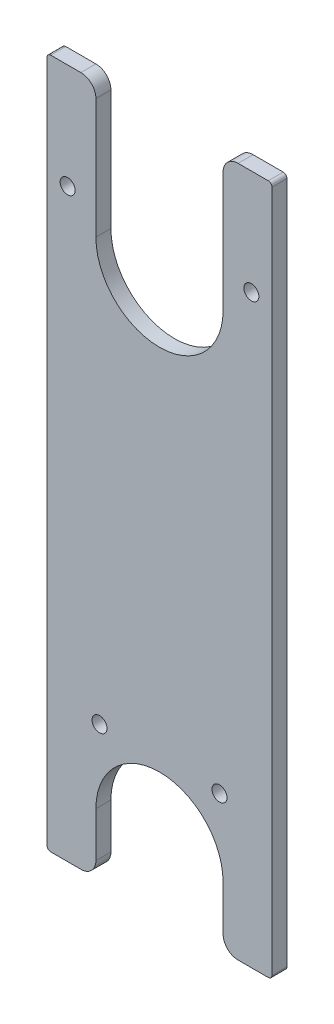
from build123d import *

# Parameters (mm, degrees)
BOSS_EXTRUDE1_DEPTH         = 6.35
FILLET1_R                   = 6.35
FILLET2_R                   = 1.5875
F_1_4_0_25_DIAMETER_HOLE1_D = 6.35


with BuildPart() as part:
    # Sketch2 → Boss-Extrude1 (new body)
    with BuildSketch(Plane.XY):
        with BuildLine():
            Line((-47.625, -279.4), (-26.924, -279.4))
            Line((-26.924, -279.4), (-26.924, -254))
            ThreePointArc((-26.924, -254), (0, -227.076), (26.924, -254))
            Line((26.924, -254), (26.924, -279.4))
            Line((26.924, -279.4), (47.625, -279.4))
            Line((47.625, -279.4), (47.625, 12.7))
            Line((47.625, 12.7), (26.924, 12.7))
            Line((26.924, 12.7), (26.924, -44.45))
            ThreePointArc((26.924, -44.45), (0, -71.374), (-26.924, -44.45))
            Line((-26.924, -44.45), (-26.924, 12.7))
            Line((-26.924, 12.7), (-47.625, 12.7))
            Line((-47.625, 12.7), (-47.625, -279.4))
        make_face()
    extrude(amount=BOSS_EXTRUDE1_DEPTH)

    # Fillet1
    fillet1_edges = [part.edges().sort_by_distance(p)[0] for p in [
        (26.924, -279.4, 3.175),
        (-26.924, -279.4, 3.175),
        (26.924, 12.7, 3.175),
        (-26.924, 12.7, 3.175),
    ]]
    fillet(fillet1_edges, radius=FILLET1_R)

    # Fillet2
    fillet2_edges = [part.edges().sort_by_distance(p)[0] for p in [
        (-47.625, 12.7, 3.175),
        (47.625, 12.7, 3.175),
        (47.625, -279.4, 3.175),
        (-47.625, -279.4, 3.175),
    ]]
    fillet(fillet2_edges, radius=FILLET2_R)

    # 1/4 (0.25) Diameter Hole1 (through all)
    with Locations(Plane.XY.offset(6.35)):
        with Locations((-25.4, -222.25), (-38.89375, -31.75), (38.89375, -31.75), (25.4, -222.25)):
            Hole(F_1_4_0_25_DIAMETER_HOLE1_D / 2)


solid = part.part
